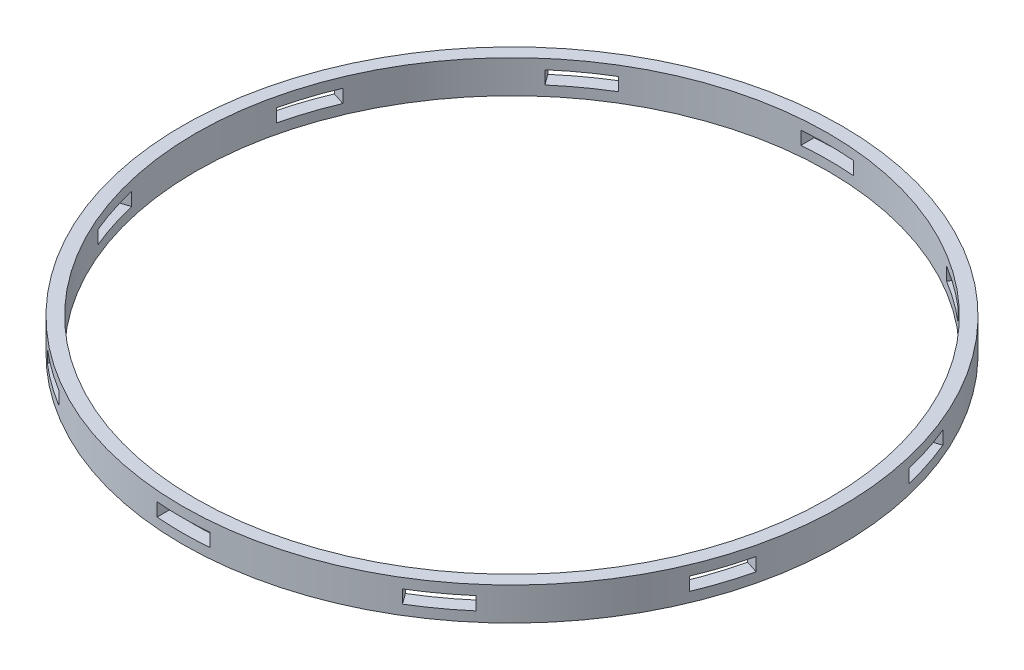
from build123d import *

# Parameters (mm, degrees)
SKETCH1_R           = 100
SKETCH1_R_2         = 96
BOSS_EXTRUDE1_DEPTH = 10
SKETCH2_W           = 16
SKETCH2_H           = 4
CUT_EXTRUDE1_DEPTH  = 142.774468788
CIRPATTERN1_COUNT   = 10


with BuildPart() as part:
    # Sketch1 → Boss-Extrude1 (new body)
    with BuildSketch(Plane(origin=(0, 0, 0), x_dir=(1, 0, 0), z_dir=(0, 1, 0))):
        Circle(SKETCH1_R)
        Circle(SKETCH1_R_2, mode=Mode.SUBTRACT)
    extrude(amount=BOSS_EXTRUDE1_DEPTH)

    # Sketch2 → Cut-Extrude1 (cut, through all)
    with BuildSketch(Plane.XY):
        with Locations((0, 5)):
            Rectangle(SKETCH2_W, SKETCH2_H)
    cut_extrude1 = extrude(amount=-CUT_EXTRUDE1_DEPTH, mode=Mode.SUBTRACT)

    # CirPattern1: Cut-Extrude1 ×10 about axis
    cirpattern1_axis = Axis((0, 10, 0), (0, -1, 0))
    for i in range(1, CIRPATTERN1_COUNT):
        add(cut_extrude1.rotate(cirpattern1_axis, i * 360 / CIRPATTERN1_COUNT), mode=Mode.SUBTRACT)


solid = part.part
